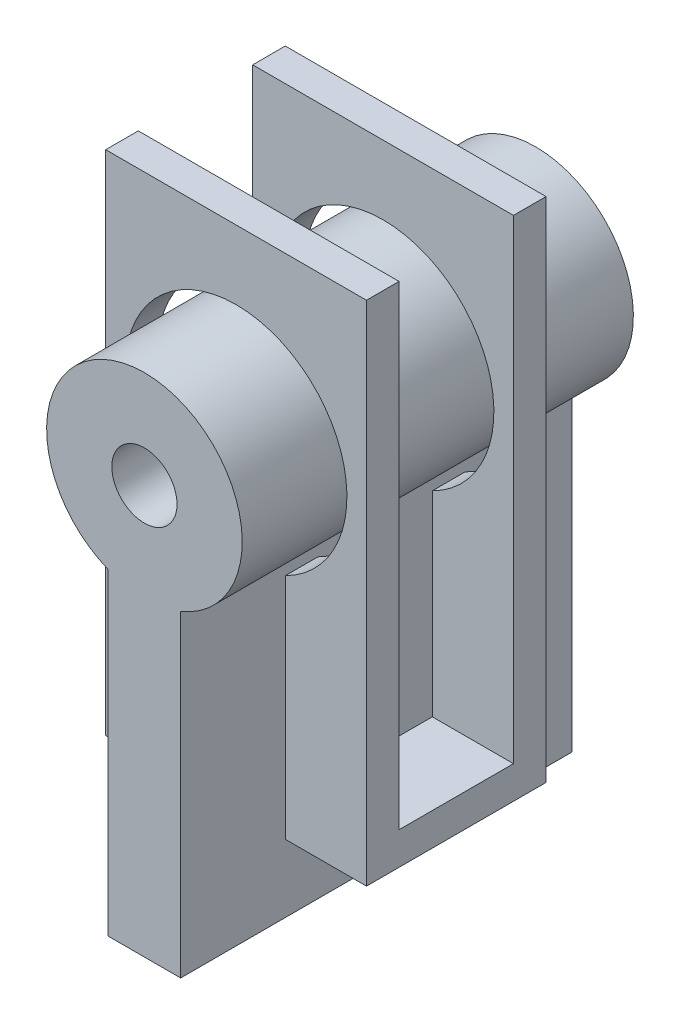
from build123d import *

# Parameters (mm, degrees)
EXTRUDE_5_DEPTH      = 30
EXTRUDE_5_DEPTH_BACK = 30
F_1_FR_R             = 5
EXTRUDE_6_DEPTH      = 20
EXTRUDE_6_DEPTH_BACK = 20
OTHER_START          = -11.605501957
OTHER_1_DEPTH        = 27.543632219
OTHER_START_2        = 10.938130262
OTHER_1_2_OUTLINE_R  = 3
OTHER_1_2_DEPTH      = 5
OTHER_1_3_OUTLINE_R  = 3
OTHER_1_3_DEPTH      = 5


# Read off the part's stored shape, not the designer's step: Отступ1
with BuildPart() as part:
    # Эскиз1_fr → Бобышка-Вытянуть5 (new, two sides: drawn at the far end of the back side and taken through both)
    with BuildSketch(Plane.XY.offset(-EXTRUDE_5_DEPTH_BACK)):
        with BuildLine():
            Line((-5.557606452, -13.932444528), (-5.557606452, -62.642280008))
            Line((-5.557606452, -62.642280008), (5.557606452, -62.642280008))
            Line((5.557606452, -62.642280008), (5.557606452, -13.932444528))
            ThreePointArc((5.557606452, -13.932444528), (0, 15), (-5.557606452, -13.932444528))
        make_face()
        Circle(F_1_FR_R, mode=Mode.SUBTRACT)
    extrude(amount=EXTRUDE_5_DEPTH + EXTRUDE_5_DEPTH_BACK)


with BuildPart() as body_2:
    # Эскиз3 → Бобышка-Вытянуть6 (new, two sides: drawn at the far end of the back side and taken through both)
    with BuildSketch(Plane(origin=(0, 0, 0), x_dir=(0, 0, -1), z_dir=(1, 0, 0)).offset(-EXTRUDE_6_DEPTH_BACK)):
        Polygon((-58.394498043, -50.25314581), (-85.938130262, -50.25314581), (-85.938130262, 27.580465306), (-80.938130262, 27.580465306), (-80.938130262, -45.25314581), (-63.394498043, -45.25314581), (-63.394498043, 27.580465306), (-58.394498043, 27.580465306), align=None)
    extrude(amount=EXTRUDE_6_DEPTH + EXTRUDE_6_DEPTH_BACK)


with BuildPart() as body_2_1:
    # Move Body 1: moved
    add(body_2.part.moved(Location((0, 0, -70))))

    # Отступ1 outline → Отступ1 (cut)
    with BuildSketch(Plane.XY.offset(OTHER_START)):
        with BuildLine():
            ThreePointArc((7.557606452, -15.227691378), (0, 17), (-7.557606452, -15.227691378))
            Line((-7.557606452, -15.227691378), (-7.557606452, -50.25314581))
            Line((-7.557606452, -50.25314581), (7.557606452, -50.25314581))
            Line((7.557606452, -50.25314581), (7.557606452, -15.227691378))
        make_face()
    extrude(amount=OTHER_1_DEPTH, mode=Mode.SUBTRACT)


with BuildPart() as body_3:
    # Other 1 2 outline → Other 1 2 (new body)
    with BuildSketch(Plane.XY.offset(OTHER_START_2)):
        Circle(OTHER_1_2_OUTLINE_R)
    extrude(amount=OTHER_1_2_DEPTH)


with BuildPart() as body_4:
    # Other 1 3 outline → Other 1 3 (new body)
    with BuildSketch(Plane.XY.offset(OTHER_START)):
        Circle(OTHER_1_3_OUTLINE_R)
    extrude(amount=OTHER_1_3_DEPTH)


solid = Compound([part.part, body_2_1.part, body_3.part, body_4.part])
